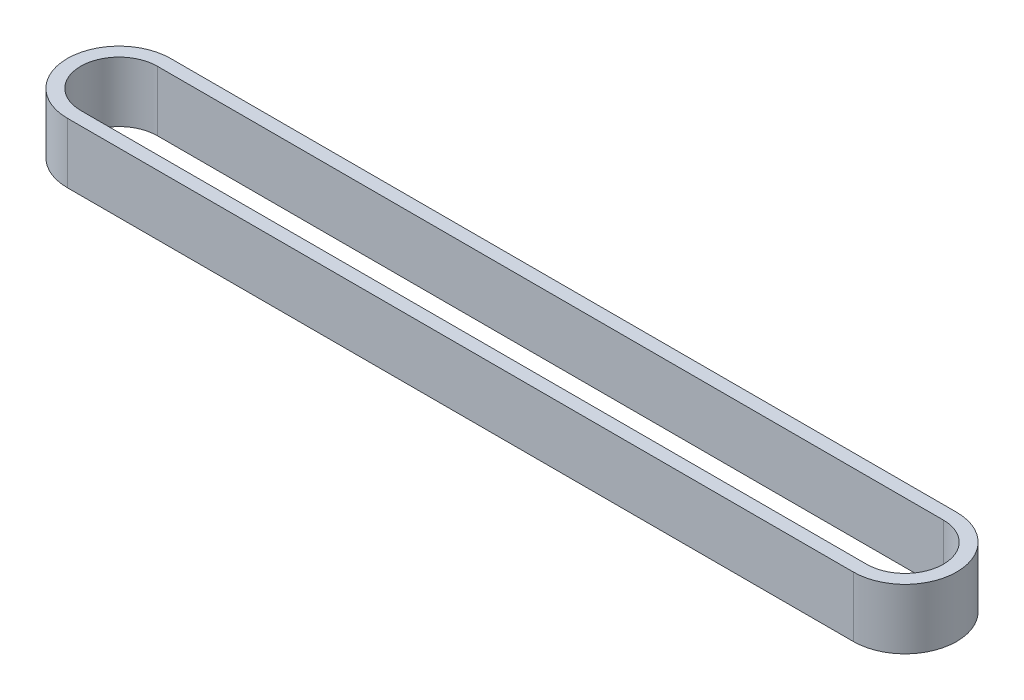
from build123d import *

# Parameters (mm, degrees)
BOSS_EXTRUDE1_DEPTH = 4.5


with BuildPart() as part:
    # Sketch1 → Boss-Extrude1 (new, symmetric)
    with BuildSketch(Plane(origin=(0, 0, 0), x_dir=(1, 0, 0), z_dir=(0, 1, 0))):
        with BuildLine():
            Line((-58.7502, 7.729577951), (58.7502, 7.729577951))
            ThreePointArc((58.7502, 7.729577951), (66.479777951, 0), (58.7502, -7.729577951))
            Line((58.7502, -7.729577951), (-58.7502, -7.729577951))
            ThreePointArc((-58.7502, -7.729577951), (-66.479777951, 0), (-58.7502, 7.729577951))
        make_face()
        with BuildLine():
            Line((-58.7502, 5.729577951), (58.7502, 5.729577951))
            ThreePointArc((58.7502, 5.729577951), (64.479777951, 0), (58.7502, -5.729577951))
            Line((58.7502, -5.729577951), (-58.7502, -5.729577951))
            ThreePointArc((-58.7502, -5.729577951), (-64.479777951, 0), (-58.7502, 5.729577951))
        make_face(mode=Mode.SUBTRACT)
    extrude(amount=BOSS_EXTRUDE1_DEPTH, both=True)


solid = part.part
